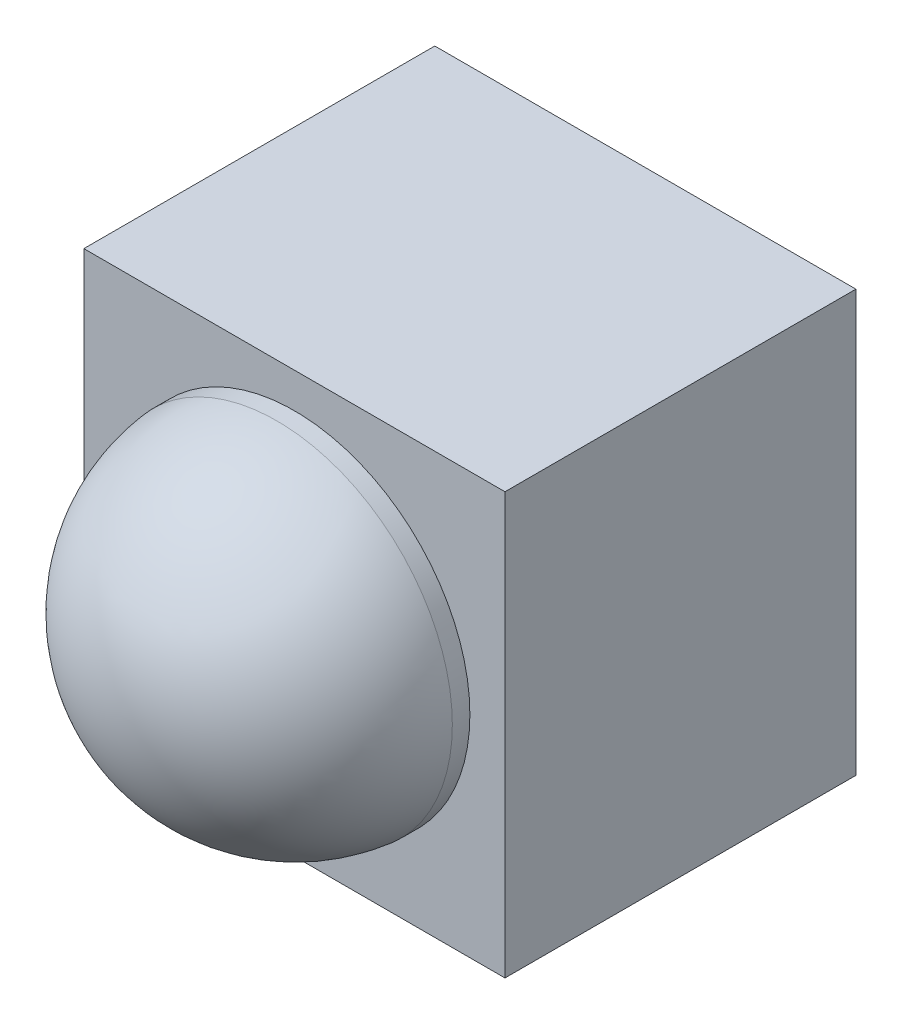
from build123d import *

# Parameters (mm, degrees)
SZKIC1_W                    = 2.4
SZKIC1_H                    = 2.4
DODANIE_WYCI_GNI_CIE1_DEPTH = 2
SZKIC2_R                    = 1
DODANIE_WYCI_GNI_CIE2_DEPTH = 0.1


# Read off the part's stored shape, not the designer's step: Kopuła2
with BuildPart() as part:
    # Szkic1 → Dodanie-wyciągnięcie1 (new body)
    with BuildSketch(Plane.XY):
        Rectangle(SZKIC1_W, SZKIC1_H)
    extrude(amount=DODANIE_WYCI_GNI_CIE1_DEPTH)

    # Szkic2 → Dodanie-wyciągnięcie2 (add)
    with BuildSketch(Plane.XY.offset(2)):
        Circle(SZKIC2_R)
    extrude(amount=DODANIE_WYCI_GNI_CIE2_DEPTH)

    # Kopuła2 outline → Kopuła2 (revolve)
    with BuildSketch(Plane.XZ):
        with BuildLine():
            Line((0, 2.1), (1, 2.099999999))
            ThreePointArc((1, 2.099999999), (0.672681203, 2.741868002), (0, 3))
            Line((0, 3), (0, 2.1))
        make_face()
    revolve(axis=Axis((0, 0, 0), (0, 0, 1)))


solid = part.part
